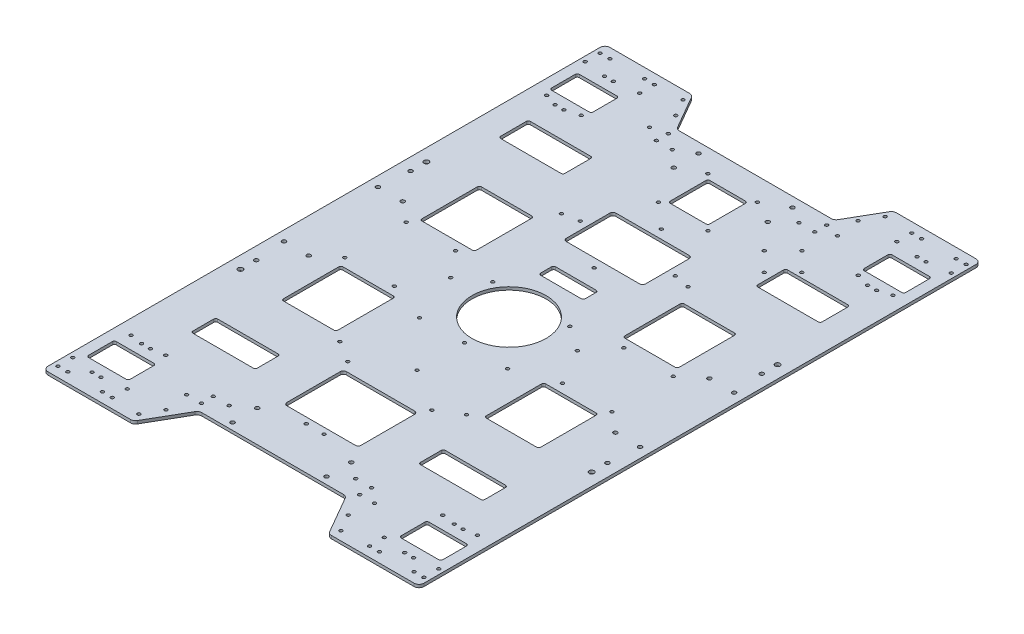
from build123d import *

# Parameters (mm, degrees)
EXTRUDE_1009_DEPTH      = 3
SKETCH_2_R              = 37.5
SKETCH_2_R_2            = 1.6
CUT_EXTRUDE_1674_DEPTH  = 3
SKETCH_8_W              = 65
SKETCH_8_H              = 25
CUT_EXTRUDE_2546_DEPTH  = 3
SKETCH_41_W             = 55
SKETCH_41_H             = 60
CUT_EXTRUDE_2_DEPTH     = 10
SKETCH_10_W             = 65
SKETCH_10_H             = 30
CUT_EXTRUDE_3752_DEPTH  = 3
SKETCH_11_R             = 1.6
SKETCH_11_W             = 42
SKETCH_11_H             = 28
CUT_EXTRUDE_4861_DEPTH  = 3
SKETCH_13_R             = 1.6
CUT_EXTRUDE_5517_DEPTH  = 3
SKETCH_14_R             = 2
CUT_EXTRUDE_5867_DEPTH  = 3
SKETCH_15_R             = 2
CUT_EXTRUDE_6127_DEPTH  = 3
SKETCH_16_R             = 1.6
CUT_EXTRUDE_6634_DEPTH  = 3
SKETCH_19_R             = 2
SKETCH_19_R_2           = 2.5
CUT_EXTRUDE_7800_DEPTH  = 3
SKETCH_21_R             = 1.6
CUT_EXTRUDE_7952_DEPTH  = 3
CUT_EXTRUDE_9_DEPTH     = 10
SKETCH_33_R             = 1.6
PC_DEPTH                = 10
SKETCH_36_R             = 1.6
CUT_EXTRUDE_9295_DEPTH  = 345.206333469
SKETCH_29_R             = 1.6
CUT_EXTRUDE_9677_DEPTH  = 10
SKETCH_39_R             = 1.6
CUT_EXTRUDE_10279_DEPTH = 10
SKETCH_42_W             = 40
SKETCH_42_H             = 40
CUT_EXTRUDE_11_DEPTH    = 10
SKETCH_34_R             = 1.6
UWB_DEPTH               = 10
SKETCH_47_R             = 1.6
CUT_EXTRUDE_13112_DEPTH = 345.206333469
SKETCH_48_R             = 1.6
CUT_EXTRUDE_14_DEPTH    = 345.206333469
CUT_EXTRUDE_6623_DEPTH  = 10
FILLET_13907_R          = 5
FILLET_14506_R          = 2
SKETCH_53_R             = 1.6
RFID_DEPTH              = 10
SKETCH_54_R             = 1.6
CUT_EXTRUDE_19127_DEPTH = 10


with BuildPart() as part:
    # 草图1 → Extrude 1009 (new body)
    with BuildSketch(Plane(origin=(0, 0, 0), x_dir=(1, 0, 0), z_dir=(0, 1, 0))):
        Polygon((190, 287), (101.545, 287), (79.605689771, 249), (-79.605689771, 249), (-101.545, 287), (-190, 287), (-190, 0), (-190, -281), (-144.091695942, -281), (-98.660254038, -281), (-74.411542732, -239), (74.411542732, -239), (98.660254038, -281), (144.091695942, -281), (190, -281), (190, 0), align=None)
    extrude(amount=EXTRUDE_1009_DEPTH)

    # 草图2 → Cut-Extrude 1674 (cut)
    with BuildSketch(Plane(origin=(0, 3, 0), x_dir=(1, 0, 0), z_dir=(0, 1, 0))):
        Circle(SKETCH_2_R)
        with Locations((38.97114317, 22.5)):
            Circle(SKETCH_2_R_2)
        with Locations((0, -45)):
            Circle(SKETCH_2_R_2)
        with Locations((-38.97114317, 22.5)):
            Circle(SKETCH_2_R_2)
    extrude(amount=-CUT_EXTRUDE_1674_DEPTH, mode=Mode.SUBTRACT)

    # 草图8 → Cut-Extrude 2546 (cut)
    with BuildSketch(Plane(origin=(0, 3, 0), x_dir=(1, 0, 0), z_dir=(0, 1, 0))):
        with Locations((115, -161.5)):
            Rectangle(SKETCH_8_W, SKETCH_8_H)
        with Locations((-115, -161.5)):
            Rectangle(SKETCH_8_W, SKETCH_8_H)
    extrude(amount=-CUT_EXTRUDE_2546_DEPTH, mode=Mode.SUBTRACT)

    # 草图41 → 减重过线孔2 (cut)
    with BuildSketch(Plane(origin=(0, 3, 0), x_dir=(1, 0, 0), z_dir=(0, 1, 0))):
        with Locations((-102.5, 70)):
            Rectangle(SKETCH_41_W, SKETCH_41_H)
        with Locations((102.5, 70)):
            Rectangle(SKETCH_41_W, SKETCH_41_H)
        with Locations((102.5, -70)):
            Rectangle(SKETCH_41_W, SKETCH_41_H)
        with Locations((-102.5, -70)):
            Rectangle(SKETCH_41_W, SKETCH_41_H)
    extrude(amount=-CUT_EXTRUDE_2_DEPTH, mode=Mode.SUBTRACT)

    # 草图10 → Cut-Extrude 3752 (cut)
    with BuildSketch(Plane(origin=(0, 3, 0), x_dir=(1, 0, 0), z_dir=(0, 1, 0))):
        with Locations((-130, 167)):
            Rectangle(SKETCH_10_W, SKETCH_10_H)
        with Locations((130, 167)):
            Rectangle(SKETCH_10_W, SKETCH_10_H)
    extrude(amount=-CUT_EXTRUDE_3752_DEPTH, mode=Mode.SUBTRACT)

    # 草图11 → Cut-Extrude 4861 (cut)
    with BuildSketch(Plane(origin=(0, 3, 0), x_dir=(1, 0, 0), z_dir=(0, 1, 0))):
        with Locations((-153.5, 259)):
            Circle(SKETCH_11_R)
        with Locations((-162.5, 259)):
            Circle(SKETCH_11_R)
        with Locations((-153.5, 209)):
            Circle(SKETCH_11_R)
        with Locations((-162.5, 209)):
            Circle(SKETCH_11_R)
        with Locations((153.5, 259)):
            Circle(SKETCH_11_R)
        with Locations((162.5, 259)):
            Circle(SKETCH_11_R)
        with Locations((153.5, 209)):
            Circle(SKETCH_11_R)
        with Locations((162.5, 209)):
            Circle(SKETCH_11_R)
        with Locations((162.5, -209)):
            Circle(SKETCH_11_R)
        with Locations((153.5, -209)):
            Circle(SKETCH_11_R)
        with Locations((162.5, -259)):
            Circle(SKETCH_11_R)
        with Locations((153.5, -259)):
            Circle(SKETCH_11_R)
        with Locations((-162.5, -209)):
            Circle(SKETCH_11_R)
        with Locations((-153.5, -209)):
            Circle(SKETCH_11_R)
        with Locations((-153.5, -259)):
            Circle(SKETCH_11_R)
        with Locations((-162.5, -259)):
            Circle(SKETCH_11_R)
        with Locations((-158, 234)):
            Rectangle(SKETCH_11_W, SKETCH_11_H)
        with Locations((158, 234)):
            Rectangle(SKETCH_11_W, SKETCH_11_H)
        with Locations((158, -234)):
            Rectangle(SKETCH_11_W, SKETCH_11_H)
        with Locations((-158, -234)):
            Rectangle(SKETCH_11_W, SKETCH_11_H)
    extrude(amount=-CUT_EXTRUDE_4861_DEPTH, mode=Mode.SUBTRACT)

    # 草图13 → Cut-Extrude 5517 (cut)
    with BuildSketch(Plane(origin=(0, 3, 0), x_dir=(1, 0, 0), z_dir=(0, 1, 0))):
        with Locations((25, 176)):
            Circle(SKETCH_13_R)
        with Locations((25, 226)):
            Circle(SKETCH_13_R)
        with Locations((-25, 226)):
            Circle(SKETCH_13_R)
        with Locations((-25, 176)):
            Circle(SKETCH_13_R)
    extrude(amount=-CUT_EXTRUDE_5517_DEPTH, mode=Mode.SUBTRACT)

    # 草图14 → Cut-Extrude 5867 (cut)
    with BuildSketch(Plane(origin=(0, 3, 0), x_dir=(1, 0, 0), z_dir=(0, 1, 0))):
        with Locations((-47.5, 239)):
            Circle(SKETCH_14_R)
        with Locations((-47.5, 214)):
            Circle(SKETCH_14_R)
        with Locations((47.5, 214)):
            Circle(SKETCH_14_R)
        with Locations((47.5, 239)):
            Circle(SKETCH_14_R)
        with Locations((-47.5, -207)):
            Circle(SKETCH_14_R)
        with Locations((-47.5, -232)):
            Circle(SKETCH_14_R)
        with Locations((47.5, -232)):
            Circle(SKETCH_14_R)
        with Locations((47.5, -207)):
            Circle(SKETCH_14_R)
    extrude(amount=-CUT_EXTRUDE_5867_DEPTH, mode=Mode.SUBTRACT)

    # 草图15 → Cut-Extrude 6127 (cut)
    with BuildSketch(Plane(origin=(0, 3, 0), x_dir=(1, 0, 0), z_dir=(0, 1, 0))):
        with Locations((155, 47.5)):
            Circle(SKETCH_15_R)
        with Locations((180, 47.5)):
            Circle(SKETCH_15_R)
        with Locations((180, -47.5)):
            Circle(SKETCH_15_R)
        with Locations((155, -47.5)):
            Circle(SKETCH_15_R)
        with Locations((-155, -47.5)):
            Circle(SKETCH_15_R)
        with Locations((-180, -47.5)):
            Circle(SKETCH_15_R)
        with Locations((-180, 47.5)):
            Circle(SKETCH_15_R)
        with Locations((-155, 47.5)):
            Circle(SKETCH_15_R)
    extrude(amount=-CUT_EXTRUDE_6127_DEPTH, mode=Mode.SUBTRACT)

    # 草图16 → Cut-Extrude 6634 (cut)
    with BuildSketch(Plane(origin=(0, 3, 0), x_dir=(1, 0, 0), z_dir=(0, 1, 0))):
        with Locations((-64, 229)):
            Circle(SKETCH_16_R)
        with Locations((-64, 117)):
            Circle(SKETCH_16_R)
        with Locations((-64, 5)):
            Circle(SKETCH_16_R)
        with Locations((-64, -107)):
            Circle(SKETCH_16_R)
        with Locations((-64, -219)):
            Circle(SKETCH_16_R)
        with Locations((64, 229)):
            Circle(SKETCH_16_R)
        with Locations((64, -107)):
            Circle(SKETCH_16_R)
        with Locations((64, 5)):
            Circle(SKETCH_16_R)
        with Locations((64, 117)):
            Circle(SKETCH_16_R)
        with Locations((64, -219)):
            Circle(SKETCH_16_R)
    extrude(amount=-CUT_EXTRUDE_6634_DEPTH, mode=Mode.SUBTRACT)

    # 草图19 → Cut-Extrude 7800 (cut)
    with BuildSketch(Plane(origin=(0, 3, 0), x_dir=(1, 0, 0), z_dir=(0, 1, 0))):
        with Locations((-177.5, -78)):
            Circle(SKETCH_19_R)
        with Locations((-177.5, -94)):
            Circle(SKETCH_19_R_2)
        with Locations((-177.5, 94)):
            Circle(SKETCH_19_R_2)
        with Locations((-177.5, 78)):
            Circle(SKETCH_19_R)
        with Locations((177.5, -94)):
            Circle(SKETCH_19_R_2)
        with Locations((177.5, -78)):
            Circle(SKETCH_19_R)
        with Locations((177.5, 78)):
            Circle(SKETCH_19_R)
        with Locations((177.5, 94)):
            Circle(SKETCH_19_R_2)
    extrude(amount=-CUT_EXTRUDE_7800_DEPTH, mode=Mode.SUBTRACT)

    # 草图21 → Cut-Extrude 7952 (cut)
    with BuildSketch(Plane(origin=(0, 3, 0), x_dir=(1, 0, 0), z_dir=(0, 1, 0))):
        with Locations((0, -93)):
            Circle(SKETCH_21_R)
    extrude(amount=-CUT_EXTRUDE_7952_DEPTH, mode=Mode.SUBTRACT)

    # 草图32 → 切除-拉伸9 (cut)
    with BuildSketch(Plane(origin=(0, 3, 0), x_dir=(1, 0, 0), z_dir=(0, 1, 0))):
        with BuildLine():
            Line((-34.5, -190), (34.5, -190))
            ThreePointArc((34.5, -190), (36.621320344, -189.121320344), (37.5, -187))
            Line((37.5, -187), (37.5, -133))
            ThreePointArc((37.5, -133), (36.621320344, -130.878679656), (34.5, -130))
            Line((34.5, -130), (-34.5, -130))
            ThreePointArc((-34.5, -130), (-36.621320344, -130.878679656), (-37.5, -133))
            Line((-37.5, -133), (-37.5, -187))
            ThreePointArc((-37.5, -187), (-36.621320344, -189.121320344), (-34.5, -190))
        make_face()
    extrude(amount=-CUT_EXTRUDE_9_DEPTH, mode=Mode.SUBTRACT)

    # 草图33 → PC座固定孔 (cut)
    with BuildSketch(Plane(origin=(0, 3, 0), x_dir=(1, 0, 0), z_dir=(0, 1, 0))):
        with Locations((-42.5, -120.5)):
            Circle(SKETCH_33_R)
        with Locations((42.5, -120.5)):
            Circle(SKETCH_33_R)
    extrude(amount=-PC_DEPTH, mode=Mode.SUBTRACT)

    # 草图36 → Cut-Extrude 9295 (cut, through all)
    with BuildSketch(Plane(origin=(0, 3, 0), x_dir=(1, 0, 0), z_dir=(0, 1, 0))):
        with Locations((-80, -231)):
            Circle(SKETCH_36_R)
        with Locations((-80, -219)):
            Circle(SKETCH_36_R)
        with Locations((80, -219)):
            Circle(SKETCH_36_R)
        with Locations((80, -231)):
            Circle(SKETCH_36_R)
        with Locations((-80, 241)):
            Circle(SKETCH_36_R)
        with Locations((-80, 229)):
            Circle(SKETCH_36_R)
        with Locations((80, 229)):
            Circle(SKETCH_36_R)
        with Locations((80, 241)):
            Circle(SKETCH_36_R)
    extrude(amount=-CUT_EXTRUDE_9295_DEPTH, mode=Mode.SUBTRACT)

    # 草图29 → Cut-Extrude 9677 (cut)
    with BuildSketch(Plane(origin=(0, 3, 0), x_dir=(1, 0, 0), z_dir=(0, 1, 0))):
        with Locations((48, 120)):
            Circle(SKETCH_29_R)
        with Locations((0, 86)):
            Circle(SKETCH_29_R)
        with Locations((0, 154)):
            Circle(SKETCH_29_R)
        with Locations((-48, 120)):
            Circle(SKETCH_29_R)
        with BuildLine():
            Line((40, 98), (40, 142))
            ThreePointArc((40, 142), (39.121320344, 144.121320344), (37, 145))
            Line((37, 145), (-37, 145))
            ThreePointArc((-37, 145), (-39.121320344, 144.121320344), (-40, 142))
            Line((-40, 142), (-40, 98))
            ThreePointArc((-40, 98), (-39.121320344, 95.878679656), (-37, 95))
            Line((-37, 95), (37, 95))
            ThreePointArc((37, 95), (39.121320344, 95.878679656), (40, 98))
        make_face()
    extrude(amount=-CUT_EXTRUDE_9677_DEPTH, mode=Mode.SUBTRACT)

    # 草图39 → Cut-Extrude 10279 (cut)
    with BuildSketch(Plane(origin=(0, 3, 0), x_dir=(1, 0, 0), z_dir=(0, 1, 0))):
        with Locations((185, -271)):
            Circle(SKETCH_39_R)
        with Locations((185, -256)):
            Circle(SKETCH_39_R)
        with Locations((130, -256)):
            Circle(SKETCH_39_R)
        with Locations((130, -271)):
            Circle(SKETCH_39_R)
        with Locations((-130, -271)):
            Circle(SKETCH_39_R)
        with Locations((-130, -256)):
            Circle(SKETCH_39_R)
        with Locations((-185, -256)):
            Circle(SKETCH_39_R)
        with Locations((-185, -271)):
            Circle(SKETCH_39_R)
        with Locations((-130, 262)):
            Circle(SKETCH_39_R)
        with Locations((-130, 277)):
            Circle(SKETCH_39_R)
        with Locations((185, 262)):
            Circle(SKETCH_39_R)
        with Locations((185, 277)):
            Circle(SKETCH_39_R)
        with Locations((-185, 277)):
            Circle(SKETCH_39_R)
        with Locations((-185, 262)):
            Circle(SKETCH_39_R)
        with Locations((130, 277)):
            Circle(SKETCH_39_R)
        with Locations((130, 262)):
            Circle(SKETCH_39_R)
    extrude(amount=-CUT_EXTRUDE_10279_DEPTH, mode=Mode.SUBTRACT)

    # 草图42 → 切除-拉伸11 (cut)
    with BuildSketch(Plane(origin=(0, 3, 0), x_dir=(1, 0, 0), z_dir=(0, 1, 0))):
        with Locations((0, 201)):
            Rectangle(SKETCH_42_W, SKETCH_42_H)
    extrude(amount=-CUT_EXTRUDE_11_DEPTH, mode=Mode.SUBTRACT)

    # 草图34 → UWB固定孔 (cut)
    with BuildSketch(Plane(origin=(0, 3, 0), x_dir=(1, 0, 0), z_dir=(0, 1, 0))):
        with Locations((90, 168)):
            Circle(SKETCH_34_R)
        with Locations((71, 187)):
            Circle(SKETCH_34_R)
        with Locations((90, 206)):
            Circle(SKETCH_34_R)
        with Locations((109, 187)):
            Circle(SKETCH_34_R)
    extrude(amount=-UWB_DEPTH, mode=Mode.SUBTRACT)

    # 草图47 → Cut-Extrude 13112 (cut, through all)
    with BuildSketch(Plane(origin=(0, 3, 0), x_dir=(1, 0, 0), z_dir=(0, 1, 0))):
        with Locations((140, 277)):
            Circle(SKETCH_47_R)
        with Locations((185, -271)):
            Circle(SKETCH_47_R)
        with Locations((95, -231)):
            Circle(SKETCH_47_R)
        with Locations((175, -271)):
            Circle(SKETCH_47_R)
        with Locations((140, 213)):
            Circle(SKETCH_47_R)
        with Locations((175, -207)):
            Circle(SKETCH_47_R)
        with Locations((-140, -271)):
            Circle(SKETCH_47_R)
        with Locations((-140, -207)):
            Circle(SKETCH_47_R)
        with Locations((-175, 213)):
            Circle(SKETCH_47_R)
        with Locations((-95, 237)):
            Circle(SKETCH_47_R)
        with Locations((185, 277)):
            Circle(SKETCH_47_R)
        with Locations((175, 277)):
            Circle(SKETCH_47_R)
        with Locations((95, 237)):
            Circle(SKETCH_47_R)
        with Locations((175, 213)):
            Circle(SKETCH_47_R)
        with Locations((-175, 277)):
            Circle(SKETCH_47_R)
        with Locations((-185, 277)):
            Circle(SKETCH_47_R)
        with Locations((140, -207)):
            Circle(SKETCH_47_R)
        with Locations((140, -271)):
            Circle(SKETCH_47_R)
        with Locations((-175, -207)):
            Circle(SKETCH_47_R)
        with Locations((-140, 213)):
            Circle(SKETCH_47_R)
        with Locations((-175, -271)):
            Circle(SKETCH_47_R)
        with Locations((-95, -231)):
            Circle(SKETCH_47_R)
        with Locations((-185, -271)):
            Circle(SKETCH_47_R)
        with Locations((-140, 277)):
            Circle(SKETCH_47_R)
    extrude(amount=-CUT_EXTRUDE_13112_DEPTH, mode=Mode.SUBTRACT)

    # 草图48 → 切除-拉伸14 (cut, through all)
    with BuildSketch(Plane(origin=(0, 3, 0), x_dir=(1, 0, 0), z_dir=(0, 1, 0))):
        with Locations((-44.5, -46)):
            Circle(SKETCH_48_R)
        with Locations((44.5, -46)):
            Circle(SKETCH_48_R)
        with Locations((-9, -196)):
            Circle(SKETCH_48_R)
        with Locations((9, -196)):
            Circle(SKETCH_48_R)
    extrude(amount=-CUT_EXTRUDE_14_DEPTH, mode=Mode.SUBTRACT)

    # 草图51 → 6623电机过线孔 (cut)
    with BuildSketch(Plane(origin=(0, 3, 0), x_dir=(1, 0, 0), z_dir=(0, 1, 0))):
        with BuildLine():
            Line((-20.5, 67.5), (20.5, 67.5))
            ThreePointArc((20.5, 67.5), (21.914213562, 66.914213562), (22.5, 65.5))
            Line((22.5, 65.5), (22.5, 54.5))
            ThreePointArc((22.5, 54.5), (21.914213562, 53.085786438), (20.5, 52.5))
            Line((20.5, 52.5), (-20.5, 52.5))
            ThreePointArc((-20.5, 52.5), (-21.914213562, 53.085786438), (-22.5, 54.5))
            Line((-22.5, 54.5), (-22.5, 65.5))
            ThreePointArc((-22.5, 65.5), (-21.914213562, 66.914213562), (-20.5, 67.5))
        make_face()
    extrude(amount=-CUT_EXTRUDE_6623_DEPTH, mode=Mode.SUBTRACT)

    # Fillet 13907
    fillet_13907_edges = [part.edges().sort_by_distance(p)[0] for p in [
        (-190, 1.5, -287),
        (-101.545, 1.5, -287),
        (-79.605689771, 1.5, -249),
        (79.605689771, 1.5, -249),
        (101.545, 1.5, -287),
        (190, 1.5, -287),
        (190, 1.5, 281),
        (98.660254038, 1.5, 281),
        (74.411542732, 1.5, 239),
        (-74.411542732, 1.5, 239),
        (-98.660254038, 1.5, 281),
        (-190, 1.5, 281),
    ]]
    fillet(fillet_13907_edges, radius=FILLET_13907_R)

    # Fillet 14506
    fillet_14506_edges = [part.edges().sort_by_distance(p)[0] for p in [
        (-147.5, 1.5, 149),
        (-82.5, 1.5, 149),
        (-82.5, 1.5, 174),
        (-147.5, 1.5, 174),
        (82.5, 1.5, 149),
        (147.5, 1.5, 149),
        (147.5, 1.5, 174),
        (82.5, 1.5, 174),
        (-130, 1.5, -100),
        (-75, 1.5, -100),
        (-75, 1.5, -40),
        (-130, 1.5, -40),
        (-130, 1.5, 100),
        (-130, 1.5, 40),
        (-75, 1.5, 40),
        (-75, 1.5, 100),
        (130, 1.5, 100),
        (75, 1.5, 100),
        (75, 1.5, 40),
        (130, 1.5, 40),
        (130, 1.5, -100),
        (130, 1.5, -40),
        (75, 1.5, -40),
        (75, 1.5, -100),
        (-97.5, 1.5, -152),
        (-162.5, 1.5, -152),
        (-162.5, 1.5, -182),
        (-97.5, 1.5, -182),
        (162.5, 1.5, -182),
        (-137, 1.5, -220),
        (-179, 1.5, -220),
        (-179, 1.5, -248),
        (-137, 1.5, -248),
        (-179, 1.5, 220),
        (-137, 1.5, 220),
        (-137, 1.5, 248),
        (179, 1.5, 248),
        (137, 1.5, 248),
        (137, 1.5, 220),
        (179, 1.5, 220),
        (179, 1.5, -248),
        (179, 1.5, -220),
        (137, 1.5, -220),
        (137, 1.5, -248),
        (20, 1.5, -181),
        (-20, 1.5, -181),
        (-20, 1.5, -221),
        (20, 1.5, -221),
        (-179, 1.5, 248),
        (162.5, 1.5, -152),
        (97.5, 1.5, -152),
        (97.5, 1.5, -182),
    ]]
    fillet(fillet_14506_edges, radius=FILLET_14506_R)

    # 草图53 → RFID固定孔 (cut)
    with BuildSketch(Plane(origin=(0, 3, 0), x_dir=(1, 0, 0), z_dir=(0, 1, 0))):
        with Locations((-135, -31)):
            Circle(SKETCH_53_R)
        with Locations((-85, -31)):
            Circle(SKETCH_53_R)
        with Locations((-85, 31)):
            Circle(SKETCH_53_R)
        with Locations((-135, 31)):
            Circle(SKETCH_53_R)
        with Locations((135, 31)):
            Circle(SKETCH_53_R)
        with Locations((85, 31)):
            Circle(SKETCH_53_R)
        with Locations((85, -31)):
            Circle(SKETCH_53_R)
        with Locations((135, -31)):
            Circle(SKETCH_53_R)
    extrude(amount=-RFID_DEPTH, mode=Mode.SUBTRACT)

    # 草图54 → Cut-Extrude 19127 (cut)
    with BuildSketch(Plane.XZ):
        with Locations((-102.122350269, -278)):
            Circle(SKETCH_54_R)
        with Locations((-92.122350269, -260.679491924)):
            Circle(SKETCH_54_R)
        with Locations((92.122350269, -260.679491924)):
            Circle(SKETCH_54_R)
        with Locations((102.122350269, -278)):
            Circle(SKETCH_54_R)
        with Locations((102.122350269, 272)):
            Circle(SKETCH_54_R)
        with Locations((92.122350269, 254.679491924)):
            Circle(SKETCH_54_R)
        with Locations((-92.122350269, 254.679491924)):
            Circle(SKETCH_54_R)
        with Locations((-102.122350269, 272)):
            Circle(SKETCH_54_R)
    extrude(amount=-CUT_EXTRUDE_19127_DEPTH, mode=Mode.SUBTRACT)


solid = part.part
